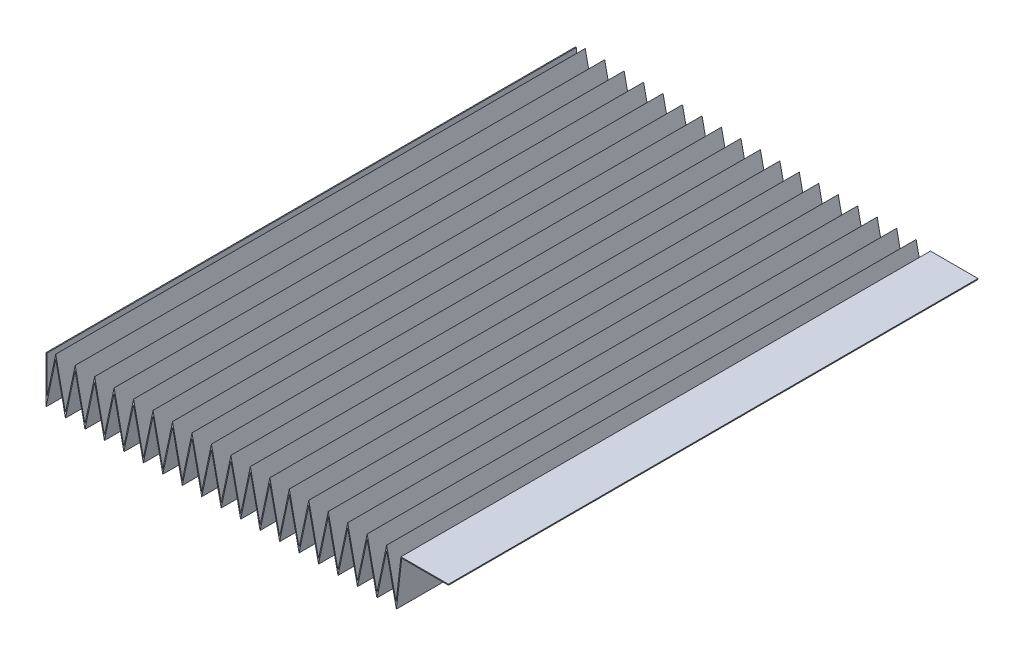
from build123d import *

# Parameters (mm, degrees)
EXTRUDE_THIN1_DEPTH = 85


with BuildPart() as part:
    # Sketch1 → Extrude-Thin1 (new, symmetric)
    with BuildSketch(Plane.XY):
        Polygon((0, 15.1), (0, 0), (3.124640073, 14.773172456), (6.249280145, 0), (9.373920218, 14.773172456), (12.498560291, 0), (15.623200364, 14.773172456), (18.747840436, 0), (21.872480509, 14.773172456), (24.997120582, 0), (28.121760655, 14.773172456), (31.246400727, 0), (34.3710408, 14.773172456), (37.495680873, 0), (40.620320946, 14.773172456), (43.744961018, 0), (46.869601091, 14.773172456), (49.994241164, 0), (53.118881237, 14.773172456), (56.243521309, 0), (59.368161382, 14.773172456), (62.492801455, 0), (65.617441528, 14.773172456), (68.7420816, 0), (71.866721673, 14.773172456), (74.991361746, 0), (78.116001819, 14.773172456), (81.240641891, 0), (84.365281964, 14.773172456), (87.489922037, 0), (90.61456211, 14.773172456), (93.739202182, 0), (96.863842255, 14.773172456), (99.988482328, 0), (103.113122401, 14.773172456), (106.237762473, 0), (109.362402546, 14.773172456), (112.487042619, 0), (114.221977776, 15), (129.221977776, 15), (129.221977776, 15.3), (113.954676479, 15.3), (112.400210139, 1.860307449), (109.362402546, 16.222939435), (106.237762473, 1.449766979), (103.113122401, 16.222939435), (99.988482328, 1.449766979), (96.863842255, 16.222939435), (93.739202182, 1.449766979), (90.61456211, 16.222939435), (87.489922037, 1.449766979), (84.365281964, 16.222939435), (81.240641891, 1.449766979), (78.116001819, 16.222939435), (74.991361746, 1.449766979), (71.866721673, 16.222939435), (68.7420816, 1.449766979), (65.617441528, 16.222939435), (62.492801455, 1.449766979), (59.368161382, 16.222939435), (56.243521309, 1.449766979), (53.118881237, 16.222939435), (49.994241164, 1.449766979), (46.869601091, 16.222939435), (43.744961018, 1.449766979), (40.620320946, 16.222939435), (37.495680873, 1.449766979), (34.3710408, 16.222939435), (31.246400727, 1.449766979), (28.121760655, 16.222939435), (24.997120582, 1.449766979), (21.872480509, 16.222939435), (18.747840436, 1.449766979), (15.623200364, 16.222939435), (12.498560291, 1.449766979), (9.373920218, 16.222939435), (6.249280145, 1.449766979), (3.124640073, 16.222939435), (0.3, 2.8681549), (0.3, 15.1), align=None)
    extrude(amount=EXTRUDE_THIN1_DEPTH, both=True)


solid = part.part
